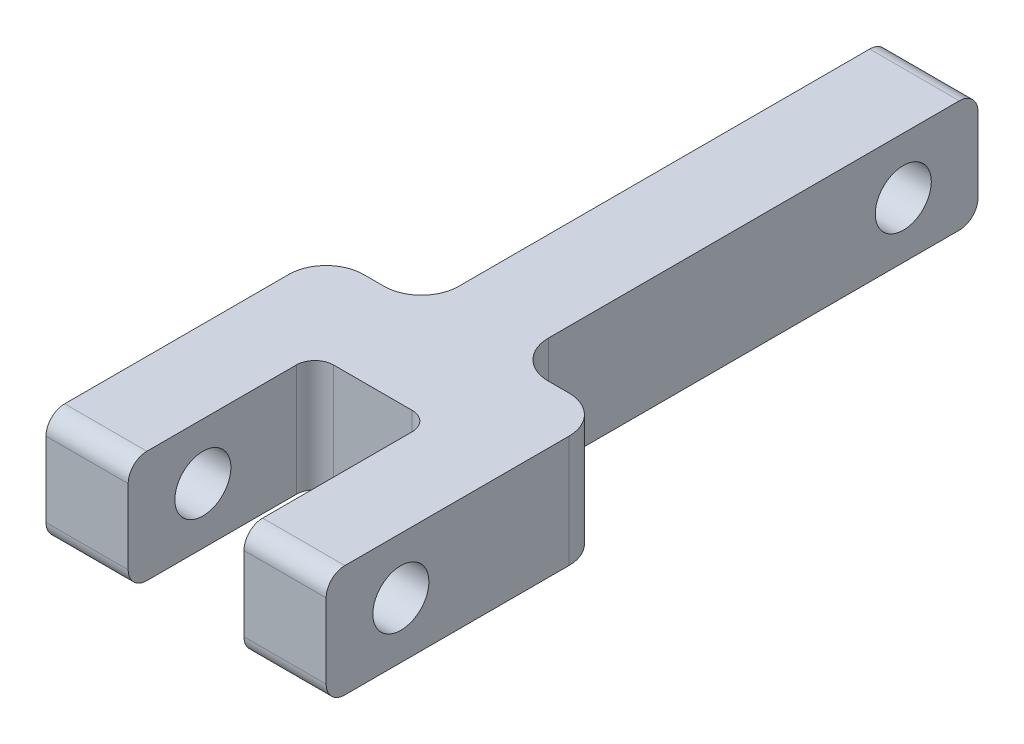
from build123d import *
from build123d.topology import SkipClean

# Parameters (mm, degrees)
SALIENTE_EXTRUIR1_DEPTH    = 2.4
CORTAR_EXTRUIR1_DEPTH      = 21.365657367
CORTAR_EXTRUIR1_DEPTH_BACK = 21.365657367
CROQUIS2_R                 = 1.5
CROQUIS3_R                 = 1.5
SALIENTE_EXTRUIR2_DEPTH    = 7.5
CORTAR_EXTRUIR2_DEPTH      = 3.1
REDONDEO1_R                = 2
REDONDEO2_R                = 1


with BuildPart() as part:
    # Croquis1 → Saliente-Extruir1 (new, symmetric)
    with BuildSketch(Plane(origin=(0, 0, 0), x_dir=(0, 0, -1), z_dir=(1, 0, 0))):
        with BuildLine():
            Line((-19, 3), (19, 3))
            ThreePointArc((19, 3), (19.707106781, 2.707106781), (20, 2))
            Line((20, 2), (20, -2))
            ThreePointArc((20, -2), (19.707106781, -2.707106781), (19, -3))
            Line((19, -3), (-19, -3))
            ThreePointArc((-19, -3), (-19.707106781, -2.707106781), (-20, -2))
            Line((-20, -2), (-20, 2))
            ThreePointArc((-20, 2), (-19.707106781, 2.707106781), (-19, 3))
        make_face()
    extrude(amount=SALIENTE_EXTRUIR1_DEPTH, both=True)

    # Croquis2 → Cortar-Extruir1 (cut, two sides: drawn at the far end of the back side and taken through both)
    with BuildSketch(Plane(origin=(0, 0, 0), x_dir=(0, 0, -1), z_dir=(1, 0, 0)).offset(-CORTAR_EXTRUIR1_DEPTH_BACK)):
        with Locations((-16, 0)):
            Circle(CROQUIS2_R)
        with Locations((16, 0)):
            Circle(CROQUIS2_R)
    extrude(amount=CORTAR_EXTRUIR1_DEPTH + CORTAR_EXTRUIR1_DEPTH_BACK, mode=Mode.SUBTRACT)

    # Croquis3 → Saliente-Extruir2 (add, symmetric)
    with SkipClean():  # the faces are left unmerged after this step: merging them gives an invalid solid
        with BuildSketch(Plane(origin=(0, 0, 0), x_dir=(0, 0, -1), z_dir=(1, 0, 0))):
            with BuildLine():
                Line((-20, 2), (-20, -2))
                ThreePointArc((-20, -2), (-19.707106781, -2.707106781), (-19, -3))
                Line((-19, -3), (-5, -3))
                Line((-5, -3), (-5, 3))
                Line((-5, 3), (-19, 3))
                ThreePointArc((-19, 3), (-19.707106781, 2.707106781), (-20, 2))
            make_face()
            with Locations((-16, 0)):
                Circle(CROQUIS3_R, mode=Mode.SUBTRACT)
        extrude(amount=SALIENTE_EXTRUIR2_DEPTH, both=True)
    add(part.part.scale(1), mode=Mode.REPLACE)  # the faces are merged on a copy

    # Croquis4 → Cortar-Extruir2 (cut, symmetric)
    with BuildSketch(Plane(origin=(0, 0, 0), x_dir=(0, 0, -1), z_dir=(1, 0, 0))):
        with BuildLine():
            Line((-19, 3), (-10, 3))
            Line((-10, 3), (-10, -3))
            Line((-10, -3), (-19, -3))
            ThreePointArc((-19, -3), (-19.707106781, -2.707106781), (-20, -2))
            Line((-20, -2), (-20, 2))
            ThreePointArc((-20, 2), (-19.707106781, 2.707106781), (-19, 3))
        make_face()
    extrude(amount=CORTAR_EXTRUIR2_DEPTH, both=True, mode=Mode.SUBTRACT)

    # Redondeo1
    redondeo1_edges = [part.edges().sort_by_distance(p)[0] for p in [
        (2.4, 0, 5),
        (-2.4, 0, 5),
        (7.5, 0, 5),
        (-7.5, 0, 5),
    ]]
    fillet(redondeo1_edges, radius=REDONDEO1_R)

    # Redondeo2
    redondeo2_edges = [part.edges().sort_by_distance(p)[0] for p in [
        (3.1, 0, 10),
        (-3.1, 0, 10),
    ]]
    fillet(redondeo2_edges, radius=REDONDEO2_R)


solid = part.part
